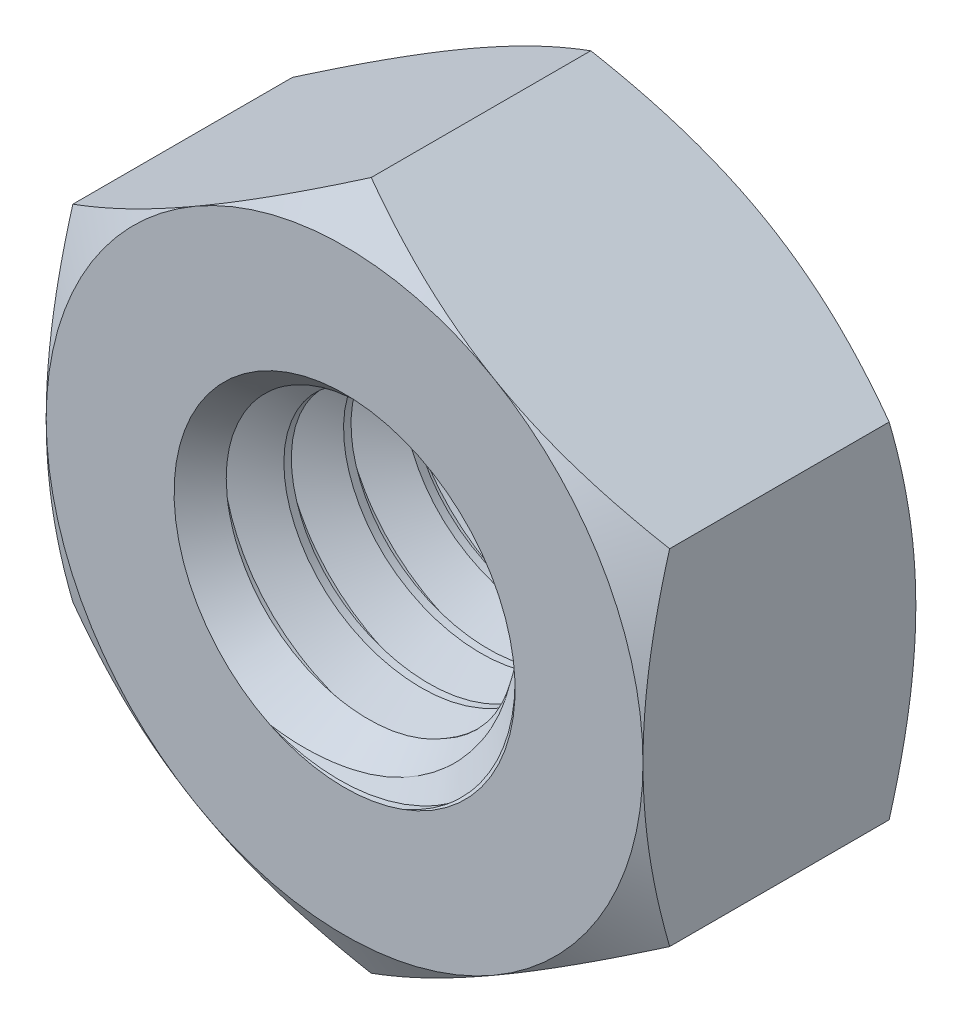
from build123d import *

# Parameters (mm, degrees)
EXTRUDE1_DEPTH          = 1.6
SKETCH13_R              = 2
BOSS_EXTRUDE1_DEPTH     = 3.2
CUT_SWEEP1_PITCH        = 0.7
SKETCH7_OUTSIDE_W       = 99.22
SKETCH7_OUTSIDE_H       = 100.302
SKETCH7_OUTSIDE_R       = 3.5
EXTRUDE2_DEPTH          = 25.4
EXTRUDE2_DRAFT          = -60
MIRROR2_COPY_1_SKETCH_W = 99.22
MIRROR2_COPY_1_SKETCH_H = 100.302
MIRROR2_COPY_1_SKETCH_R = 3.5
MIRROR2_COPY_1_DEPTH    = 25.4
MIRROR2_COPY_1_DRAFT    = -60


with BuildPart() as part:
    # Sketch1 → Extrude1 (new, symmetric)
    with BuildSketch(Plane.XY):
        Polygon((-3.5, 2.020725942), (-3.5, -2.020725942), (0, -4.041451884), (3.5, -2.020725942), (3.5, 2.020725942), (0, 4.041451884), align=None)
    extrude(amount=EXTRUDE1_DEPTH, both=True)

    # Cut-Extrude2 cone 1 section (through the dimple's axis) → Cut-Extrude2 (revolve, cut)
    with BuildSketch(Plane(origin=(0, 0, 1.6), x_dir=(0, -1, 0), z_dir=(1, 0, 0))):
        Polygon((0, 0), (2, 0), (0, 2), align=None)
    revolve(axis=Axis((0, 0, 1.6), (0, 0, -1)), mode=Mode.SUBTRACT)

    # Cut-Extrude3 cone 1 section (through the dimple's axis) → Cut-Extrude3 (revolve, cut)
    with BuildSketch(Plane(origin=(0, 0, -1.6), x_dir=(0, 1, 0), z_dir=(1, 0, 0))):
        Polygon((0, 0), (2, 0), (0, 2), align=None)
    revolve(axis=Axis((0, 0, -1.6), (0, 0, 1)), mode=Mode.SUBTRACT)


with BuildPart() as body_2:
    # Sketch13 → Boss-Extrude1 (new body)
    with BuildSketch(Plane(origin=(0, 0, -1.6), x_dir=(-1, 0, 0), z_dir=(0, 0, -1))):
        Circle(SKETCH13_R)
    extrude(amount=-BOSS_EXTRUDE1_DEPTH)

    # Cut-Sweep1: arcs per turn and ends read off the stored shape
    # Cut-Sweep1: the profile of Sketch12 profile screwed along a left-hand helix through 6.666667 turns, 6 arcs to a turn; built about Z, then put on its axis
    cut_sweep1_z = Axis((0, 0, 0), (0, 0, 1))
    cut_sweep1_corners = [(2.0003, 0, -1.312673205), (2.0003, 0, -0.699826795), (1.545336663, 0, -0.9625), (1.545336663, 0, -1.05)]
    with BuildLine(mode=Mode.PRIVATE) as cut_sweep1_profile:
        Line(cut_sweep1_corners[0], cut_sweep1_corners[1])
        Line(cut_sweep1_corners[1], cut_sweep1_corners[2])
        Line(cut_sweep1_corners[2], cut_sweep1_corners[3])
        Line(cut_sweep1_corners[3], cut_sweep1_corners[0])
    cut_sweep1_cap = Face(cut_sweep1_profile.wire())
    cut_sweep1_turn_angles = [0, -30, -60, -90, -120, -150, -180, -210, -240, -270, -300, -330, -360]
    cut_sweep1_turn_weights = [1, 0.8660254037844387, 1, 0.8660254037844387, 1, 0.8660254037844387, 1, 0.8660254037844387, 1, 0.8660254037844387, 1, 0.8660254037844387, 1]
    cut_sweep1_turn_rails = [Edge.make_bspline([Vector(p[0], p[1], 0).rotate(cut_sweep1_z, cut_sweep1_turn_angles[k]) / cut_sweep1_turn_weights[k] + Vector(0, 0, p[2] + -CUT_SWEEP1_PITCH * cut_sweep1_turn_angles[k] / 360) for k in range(13)], [0, 0, 0, 1, 1, 2, 2, 3, 3, 4, 4, 5, 5, 6, 6, 6], 2, cut_sweep1_turn_weights) for p in cut_sweep1_corners]
    cut_sweep1_turn_sides = [Face.make_surface_from_curves(cut_sweep1_turn_rails[p[0]], cut_sweep1_turn_rails[p[1]]) for p in [(0, 1), (1, 2), (2, 3), (3, 0)]]
    cut_sweep1_last_angles = [-2160, -2190, -2220, -2250, -2280, -2310, -2340, -2370, -2400]
    cut_sweep1_last_weights = [1, 0.8660254037844387, 1, 0.8660254037844387, 1, 0.8660254037844387, 1, 0.8660254037844387, 1]
    cut_sweep1_last_rails = [Edge.make_bspline([Vector(p[0], p[1], 0).rotate(cut_sweep1_z, cut_sweep1_last_angles[k]) / cut_sweep1_last_weights[k] + Vector(0, 0, p[2] + -CUT_SWEEP1_PITCH * cut_sweep1_last_angles[k] / 360) for k in range(9)], [0, 0, 0, 1, 1, 2, 2, 3, 3, 4, 4, 4], 2, cut_sweep1_last_weights) for p in cut_sweep1_corners]
    cut_sweep1_last_sides = [Face.make_surface_from_curves(cut_sweep1_last_rails[p[0]], cut_sweep1_last_rails[p[1]]) for p in [(0, 1), (1, 2), (2, 3), (3, 0)]]
    cut_sweep1 = Plane(origin=(0, 0, -1.6), x_dir=(0, 1, 0), z_dir=(0, 0, 1)) * Solid(Shell([*[p.moved(Location((0, 0, CUT_SWEEP1_PITCH * i))) for i in range(6) for p in cut_sweep1_turn_sides], *cut_sweep1_last_sides, cut_sweep1_cap, cut_sweep1_cap.rotate(cut_sweep1_z, -2400).moved(Location((0, 0, -CUT_SWEEP1_PITCH * -2400 / 360)))]))
    add(cut_sweep1, mode=Mode.SUBTRACT)


with BuildPart() as part_1:
    add(part.part)

    # Combine1: cut body 2
    add(body_2.part, mode=Mode.SUBTRACT)


with BuildPart() as extrude2_tool:
    # Sketch7 outside → Extrude2 (with draft: the straight prism first)
    with BuildSketch(Plane.XY.offset(1.6)):
        Rectangle(SKETCH7_OUTSIDE_W, SKETCH7_OUTSIDE_H)
        Circle(SKETCH7_OUTSIDE_R, mode=Mode.SUBTRACT)
    extrude(amount=-EXTRUDE2_DEPTH)
    # Extrude2: the draft: its side faces are tilted about the plane it starts from
    extrude2_sides = [extrude2_tool.faces().sort_by_distance(p)[0] for p in [
        (0, -50.151, -11.1),
        (49.61, 0, -11.1),
        (0, 50.151, -11.1),
        (-49.61, 0, -11.1),
        (-3.5, 0, -11.1),
    ]]
    draft(extrude2_sides, Plane.XY.offset(1.6), EXTRUDE2_DRAFT)


with BuildPart() as part_2:
    add(part_1.part)

    # Extrude2: cut by extrude2_tool
    add(extrude2_tool.part, mode=Mode.SUBTRACT)


with BuildPart() as mirror2_copy_1_tool:
    # Mirror2 copy 1 sketch → Mirror2 copy 1 (with draft: the straight prism first)
    with BuildSketch(Plane(origin=(0, 0, -1.6), x_dir=(1, 0, 0), z_dir=(0, 0, -1))):
        Rectangle(MIRROR2_COPY_1_SKETCH_W, MIRROR2_COPY_1_SKETCH_H)
        Circle(MIRROR2_COPY_1_SKETCH_R, mode=Mode.SUBTRACT)
    extrude(amount=-MIRROR2_COPY_1_DEPTH)
    # Mirror2 copy 1: the draft: its side faces are tilted about the plane it starts from
    mirror2_copy_1_sides = [mirror2_copy_1_tool.faces().sort_by_distance(p)[0] for p in [
        (0, -50.151, 11.1),
        (49.61, 0, 11.1),
        (0, 50.151, 11.1),
        (-49.61, 0, 11.1),
        (-3.5, 0, 11.1),
    ]]
    draft(mirror2_copy_1_sides, Plane(origin=(0, 0, -1.6), x_dir=(1, 0, 0), z_dir=(0, 0, -1)), MIRROR2_COPY_1_DRAFT)


with BuildPart() as part_3:
    add(part_2.part)

    # Mirror2 copy 1: cut by mirror2_copy_1_tool
    add(mirror2_copy_1_tool.part, mode=Mode.SUBTRACT)


solid = part_3.part
